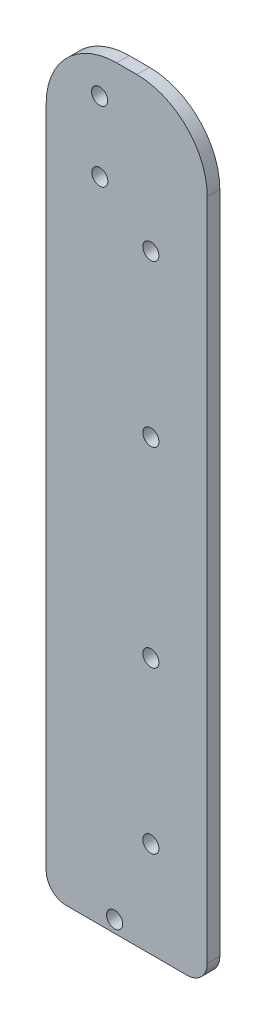
from build123d import *

# Parameters (mm, degrees)
SKETCH1_R           = 2.032
BOSS_EXTRUDE2_DEPTH = 3.175


with BuildPart() as part:
    # Sketch1 → Boss-Extrude2 (new body)
    with BuildSketch(Plane.XY):
        with BuildLine():
            Line((40.64, 5.08), (40.64, 172.72))
            ThreePointArc((40.64, 172.72), (35.432358569, 185.292358569), (22.86, 190.5))
            Line((22.86, 190.5), (17.78, 190.5))
            ThreePointArc((17.78, 190.5), (5.207641431, 185.292358569), (0, 172.72))
            Line((0, 172.72), (0, 5.08))
            ThreePointArc((0, 5.08), (1.487897552, 1.487897552), (5.08, 0))
            Line((5.08, 0), (26.416, 0))
            Line((26.416, 0), (35.56, 0))
            ThreePointArc((35.56, 0), (39.152102448, 1.487897552), (40.64, 5.08))
        make_face()
        with Locations((26.416, 24.13)):
            Circle(SKETCH1_R, mode=Mode.SUBTRACT)
        with Locations((26.416, 64.77)):
            Circle(SKETCH1_R, mode=Mode.SUBTRACT)
        with Locations((26.416, 113.03)):
            Circle(SKETCH1_R, mode=Mode.SUBTRACT)
        with Locations((26.416, 153.67)):
            Circle(SKETCH1_R, mode=Mode.SUBTRACT)
        with Locations((17.272, 3.048)):
            Circle(SKETCH1_R, mode=Mode.SUBTRACT)
        with Locations((13.531045562, 163.449)):
            Circle(SKETCH1_R, mode=Mode.SUBTRACT)
        with Locations((13.492529792, 181.102)):
            Circle(SKETCH1_R, mode=Mode.SUBTRACT)
    extrude(amount=BOSS_EXTRUDE2_DEPTH)


solid = part.part
